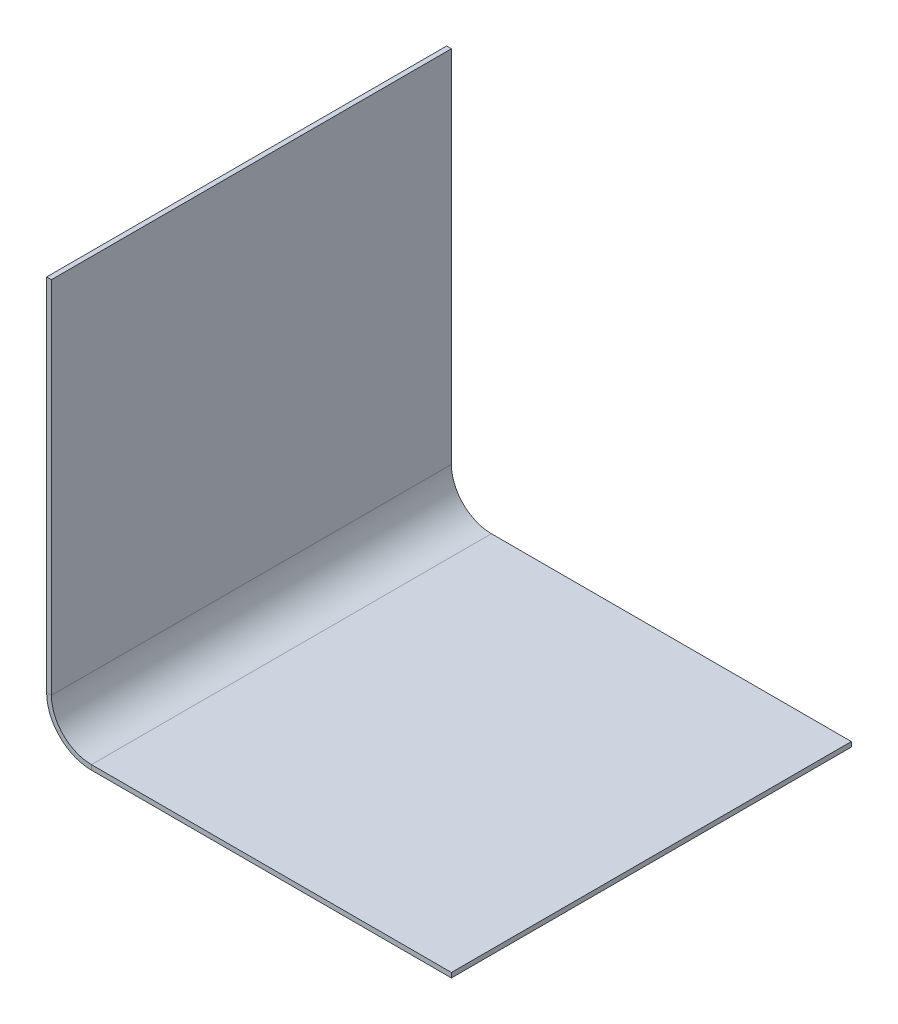
from build123d import *

# Parameters (mm, degrees)
SM_BASE_FLANGE_1_DEPTH = 100


# Sheet-metal steps are written as plain solids
with BuildPart() as part:
    # Sketch 1 → 基体-法兰1 (new body)
    with BuildSketch(Plane.XY):
        with BuildLine():
            Line((-73.674631656, 62.24754593), (-73.674631656, -27.75245407))
            ThreePointArc((-73.674631656, -27.75245407), (-70.745699468, -34.823521882), (-63.674631656, -37.75245407))
            Line((-63.674631656, -37.75245407), (26.325368344, -37.75245407))
            Line((26.325368344, -37.75245407), (26.325368344, -38.95245407))
            Line((26.325368344, -38.95245407), (-63.674631656, -38.95245407))
            ThreePointArc((-63.674631656, -38.95245407), (-71.594227605, -35.67205002), (-74.874631656, -27.75245407))
            Line((-74.874631656, -27.75245407), (-74.874631656, 62.24754593))
            Line((-74.874631656, 62.24754593), (-73.674631656, 62.24754593))
        make_face()
    extrude(amount=SM_BASE_FLANGE_1_DEPTH)


solid = part.part
